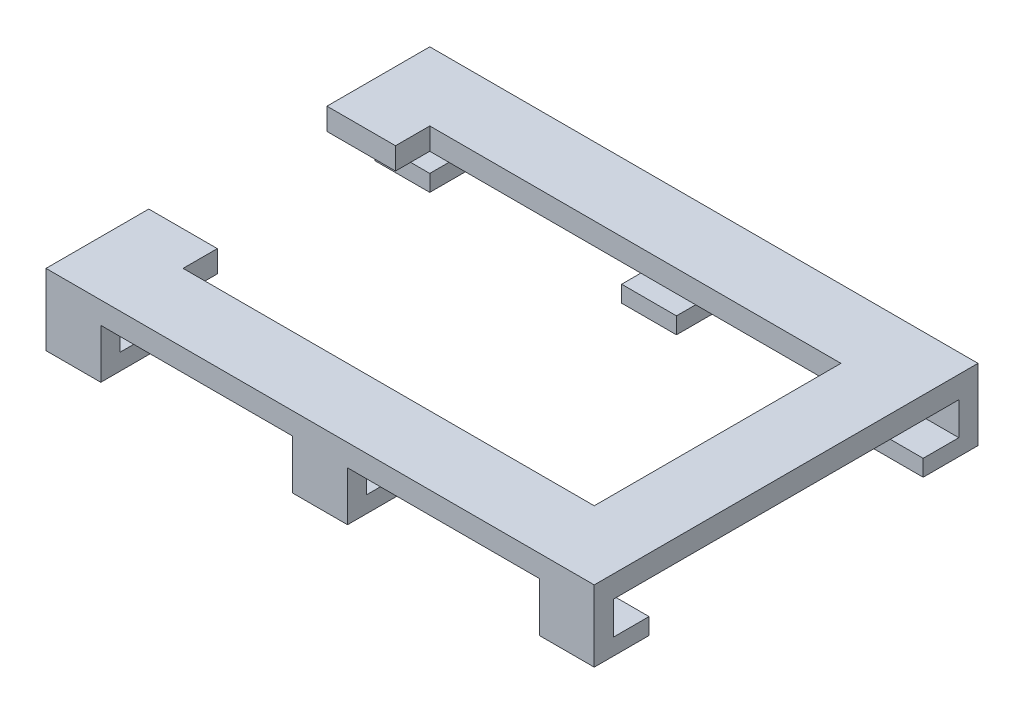
from build123d import *

# Parameters (mm, degrees)
CROQUIS1_W              = 200
CROQUIS1_H              = 140
CROQUIS1_W_2            = 150
CROQUIS1_H_2            = 90
SALIENTE_EXTRUIR1_DEPTH = 8
SALIENTE_EXTRUIR2_DEPTH = 20
SIMETR_A2_COPY_1_DEPTH  = 20
SIMETR_A2_COPY_2_DEPTH  = 20
CROQUIS3_W              = 60
CROQUIS3_H              = 65
CORTAR_EXTRUIR1_DEPTH   = 125.803846095
SALIENTE_EXTRUIR3_DEPTH = 10


with BuildPart() as part:
    # Croquis1 → Saliente-Extruir1 (new body)
    with BuildSketch(Plane(origin=(0, 0, 0), x_dir=(1, 0, 0), z_dir=(0, 1, 0))):
        Rectangle(CROQUIS1_W, CROQUIS1_H)
        Rectangle(CROQUIS1_W_2, CROQUIS1_H_2, mode=Mode.SUBTRACT)
    extrude(amount=SALIENTE_EXTRUIR1_DEPTH)

    # Croquis2 → Saliente-Extruir2 (add)
    with BuildSketch(Plane.ZY.offset(100)):
        Polygon((70, 0), (70, -18), (50, -18), (50, -12), (63, -12), (63, 0), align=None)
    saliente_extruir2 = extrude(amount=-SALIENTE_EXTRUIR2_DEPTH)

    # Simetría1: Saliente-Extruir2 across plane
    add(saliente_extruir2.mirror(Plane(origin=(0, 0, 0), x_dir=(0, 0, 1), z_dir=(1, 0, 0))))

    # Simetría2 copy 1 sketch → Simetría2 copy 1 (add)
    with BuildSketch(Plane(origin=(100, 0, 0), x_dir=(0, 0, -1), z_dir=(1, 0, 0))):
        Polygon((70, 0), (70, -18), (50, -18), (50, -12), (63, -12), (63, 0), align=None)
    extrude(amount=-SIMETR_A2_COPY_1_DEPTH)

    # Simetría2 copy 2 sketch → Simetría2 copy 2 (add)
    with BuildSketch(Plane(origin=(-100, 0, 0), x_dir=(0, 0, -1), z_dir=(-1, 0, 0))):
        Polygon((70, 0), (70, 18), (50, 18), (50, 12), (63, 12), (63, 0), align=None)
    extrude(amount=-SIMETR_A2_COPY_2_DEPTH)

    # Croquis3 → Cortar-Extruir1 (cut, through all)
    with BuildSketch(Plane(origin=(0, 8, 0), x_dir=(1, 0, 0), z_dir=(0, 1, 0))):
        with Locations((-90, 0)):
            Rectangle(CROQUIS3_W, CROQUIS3_H)
    extrude(amount=-CORTAR_EXTRUIR1_DEPTH, mode=Mode.SUBTRACT)

    # Croquis4 → Saliente-Extruir3 (add, symmetric)
    with BuildSketch(Plane(origin=(0, 0, 0), x_dir=(0, 0, -1), z_dir=(1, 0, 0))):
        Polygon((-50, -18), (-70, -18), (-70, 0), (-63, 0), (-63, -12), (-50, -12), align=None)
    saliente_extruir3 = extrude(amount=SALIENTE_EXTRUIR3_DEPTH, both=True)

    # Simetría4: Saliente-Extruir3 across plane
    add(saliente_extruir3.mirror(Plane.XY))


solid = part.part
